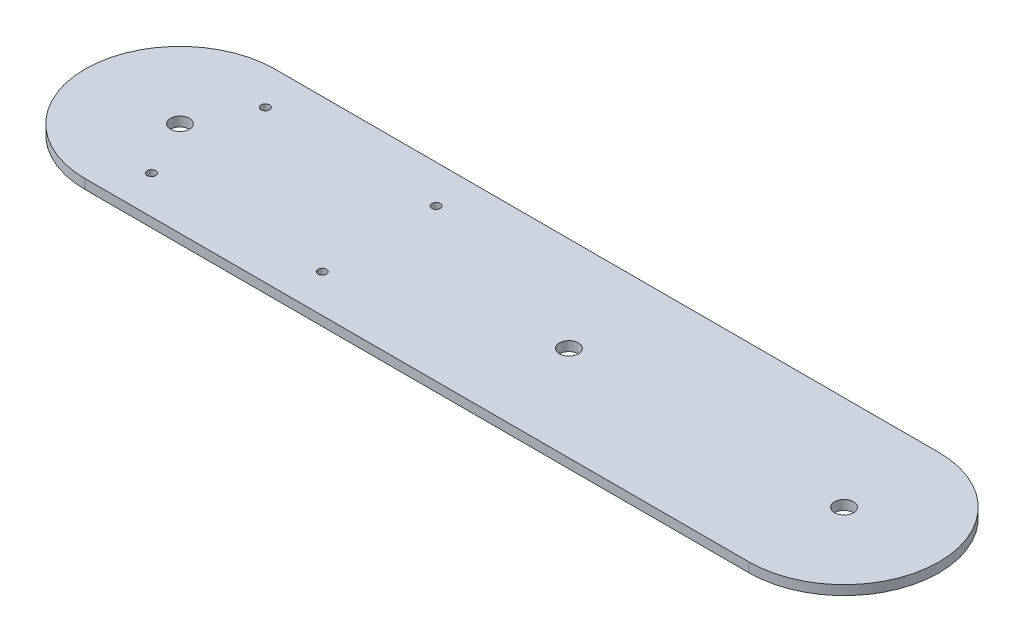
from build123d import *

# Parameters (mm, degrees)
SKETCH1_R           = 5
BOSS_EXTRUDE1_DEPTH = 5
SKETCH2_R           = 2.25
SKETCH2_R_2         = 5
CUT_EXTRUDE1_DEPTH  = 5


with BuildPart() as part:
    # Sketch1 → Boss-Extrude1 (new body)
    with BuildSketch(Plane(origin=(0, 0, 0), x_dir=(1, 0, 0), z_dir=(0, 1, 0))):
        with BuildLine():
            Line((0, 50), (350, 50))
            ThreePointArc((350, 50), (400, 0), (350, -50))
            Line((350, -50), (0, -50))
            ThreePointArc((0, -50), (-50, 0), (0, 50))
        make_face()
        Circle(SKETCH1_R, mode=Mode.SUBTRACT)
        with Locations((350, 0)):
            Circle(SKETCH1_R, mode=Mode.SUBTRACT)
    extrude(amount=BOSS_EXTRUDE1_DEPTH)

    # Sketch2 → Cut-Extrude1 (cut)
    with BuildSketch(Plane(origin=(0, 5, 0), x_dir=(1, 0, 0), z_dir=(0, 1, 0))):
        with Locations((15, -30)):
            Circle(SKETCH2_R)
        with Locations((105, -30)):
            Circle(SKETCH2_R)
        with Locations((105, 30)):
            Circle(SKETCH2_R)
        with Locations((15, 30)):
            Circle(SKETCH2_R)
        with Locations((205, 0)):
            Circle(SKETCH2_R_2)
    extrude(amount=-CUT_EXTRUDE1_DEPTH, mode=Mode.SUBTRACT)


solid = part.part
